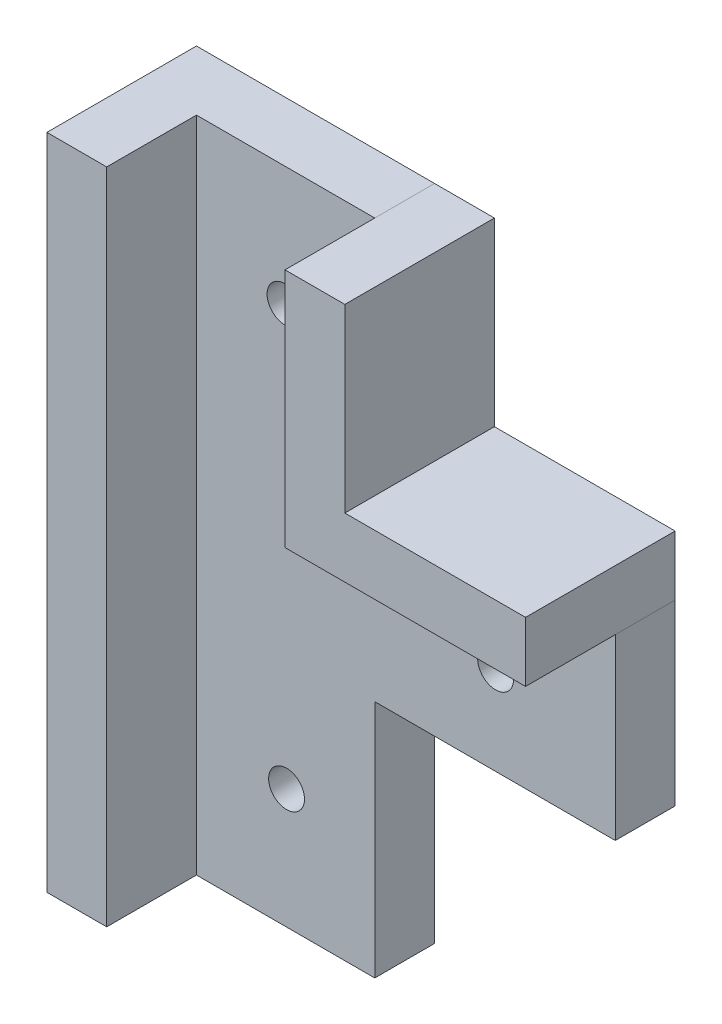
from build123d import *

# Parameters (mm, degrees)
BOSS_EXTRUDE1_DEPTH = 5
BOSS_EXTRUDE2_DEPTH = 12.5
BOSS_EXTRUDE3_DEPTH = 12.5
SKETCH4_R           = 1.5
CUT_EXTRUDE1_DEPTH  = 55.85542736
SKETCH6_W           = 14.9
SKETCH6_H           = 20
BOSS_EXTRUDE4_DEPTH = 5
SKETCH8_R           = 1.5
CUT_EXTRUDE2_DEPTH  = 54.936239309


with BuildPart() as part:
    # Sketch1 → Boss-Extrude1 (new body)
    with BuildSketch(Plane.XY):
        Polygon((7.370119522, -25.806772908), (27.470119522, -25.806772908), (27.470119522, -10.906772908), (7.370119522, -10.906772908), (7.370119522, 9.193227092), (-7.529880478, 9.193227092), (-7.529880478, -25.806772908), align=None)
    extrude(amount=BOSS_EXTRUDE1_DEPTH)

    # Sketch4 → Cut-Extrude1 (cut, through all)
    with BuildSketch(Plane(origin=(0, 0, 0), x_dir=(-1, 0, 0), z_dir=(0, 0, -1))):
        with Locations((0.129880478, -0.806772908)):
            Circle(SKETCH4_R)
        with Locations((-17.470119522, -18.406772908)):
            Circle(SKETCH4_R)
    extrude(amount=-CUT_EXTRUDE1_DEPTH, mode=Mode.SUBTRACT)



with BuildPart() as body_2:
    # Sketch2 → Boss-Extrude2 (new body)
    with BuildSketch(Plane(origin=(0, 0, 0), x_dir=(-1, 0, 0), z_dir=(0, 0, -1))):
        Polygon((-7.370119522, 9.193227092), (-12.370119522, 9.193227092), (-12.370119522, -5.906772908), (-27.470119522, -5.906772908), (-27.470119522, -10.906772908), (-7.370119522, -10.906772908), align=None)
    extrude(amount=-BOSS_EXTRUDE2_DEPTH)


with BuildPart() as body_3:
    # Sketch3 → Boss-Extrude3 (new body)
    with BuildSketch(Plane(origin=(0, 0, 0), x_dir=(-1, 0, 0), z_dir=(0, 0, -1))):
        Polygon((7.529880478, 9.193227092), (12.529880478, 9.193227092), (12.529880478, -45.806772908), (7.529880478, -45.806772908), (7.529880478, -25.806772908), align=None)
    extrude(amount=-BOSS_EXTRUDE3_DEPTH)


with BuildPart() as part_1:
    add(part.part)

    add(body_3.part)  # Boss-Extrude4 merges body 3
    # Sketch6 → Boss-Extrude4 (add)
    with BuildSketch(Plane.XY.offset(5)):
        with Locations((-0.079880478, -35.806772908)):
            Rectangle(SKETCH6_W, SKETCH6_H)
    extrude(amount=-BOSS_EXTRUDE4_DEPTH)

    # Sketch8 → Cut-Extrude2 (cut, through all)
    with BuildSketch(Plane.XY.offset(5)):
        with Locations((0, -35.806772908)):
            Circle(SKETCH8_R)
    extrude(amount=-CUT_EXTRUDE2_DEPTH, mode=Mode.SUBTRACT)


solid = Compound([body_2.part, part_1.part])
